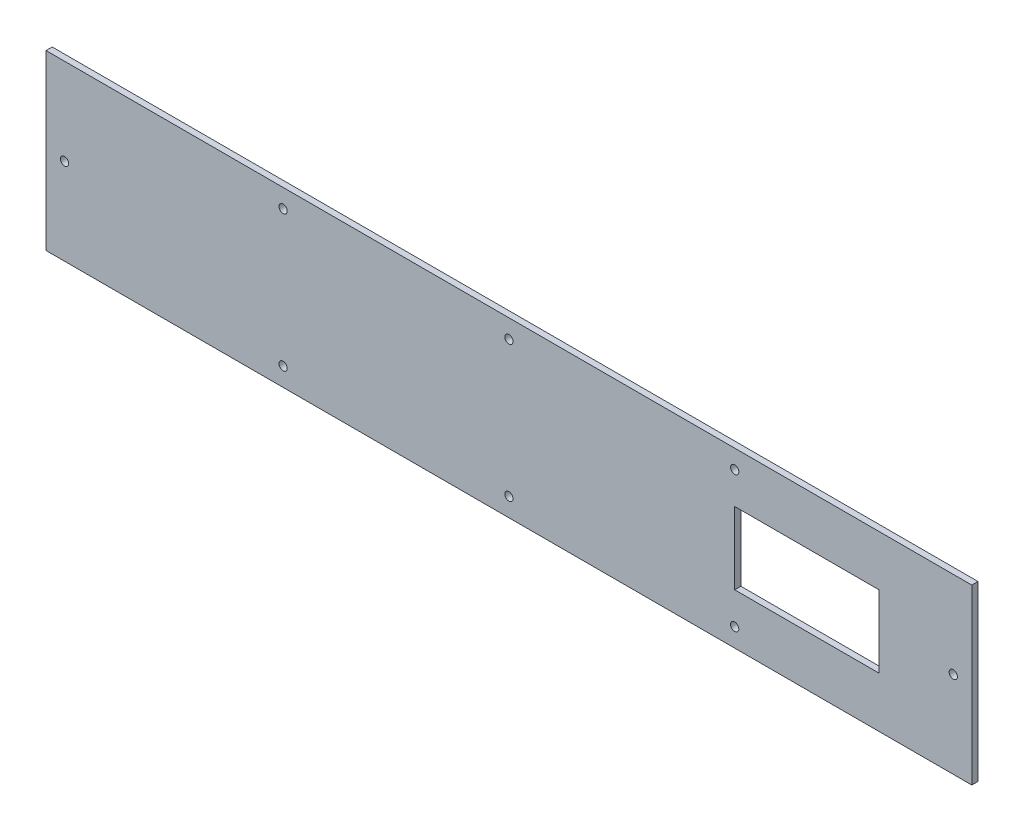
from build123d import *

# Parameters (mm, degrees)
SKETCH_F_W                   = 449
SKETCH_F_H                   = 84
SKETCH_F_R                   = 2
SKETCH_F_W_2                 = 70
SKETCH_F_H_2                 = 35
ESTRUSIONE_ESTRUSIONE1_DEPTH = 3


with BuildPart() as part:
    # Sketch f → Estrusione-Estrusione1 (new body)
    with BuildSketch(Plane.XY):
        with Locations((224.5, 42)):
            Rectangle(SKETCH_F_W, SKETCH_F_H)
        with Locations((9, 42)):
            Circle(SKETCH_F_R, mode=Mode.SUBTRACT)
        with Locations((224.5, 75)):
            Circle(SKETCH_F_R, mode=Mode.SUBTRACT)
        with Locations((224.5, 9)):
            Circle(SKETCH_F_R, mode=Mode.SUBTRACT)
        with Locations((440, 42)):
            Circle(SKETCH_F_R, mode=Mode.SUBTRACT)
        with Locations((334, 75)):
            Circle(SKETCH_F_R, mode=Mode.SUBTRACT)
        with Locations((334, 9)):
            Circle(SKETCH_F_R, mode=Mode.SUBTRACT)
        with Locations((115, 9)):
            Circle(SKETCH_F_R, mode=Mode.SUBTRACT)
        with Locations((115, 75)):
            Circle(SKETCH_F_R, mode=Mode.SUBTRACT)
        with Locations((369, 42)):
            Rectangle(SKETCH_F_W_2, SKETCH_F_H_2, mode=Mode.SUBTRACT)
    extrude(amount=ESTRUSIONE_ESTRUSIONE1_DEPTH)


solid = part.part
